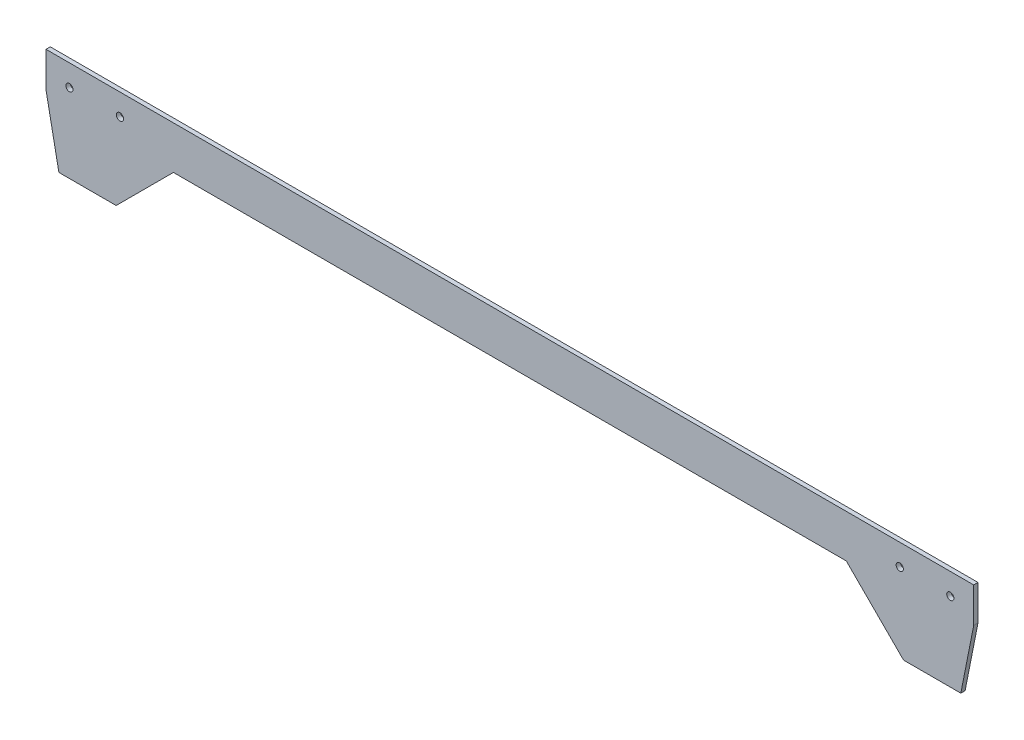
from build123d import *

# Parameters (mm, degrees)
CROQUIS1_R              = 5
SALIENTE_EXTRUIR1_DEPTH = 6


with BuildPart() as part:
    # Croquis1 → Saliente-Extruir1 (new body)
    with BuildSketch(Plane.XY):
        Polygon((-560, 30), (-600, 30), (-648, 30), (-648, -19), (-630, -110), (-600, -110), (-550, -110), (-470, -30), (470, -30), (550, -110), (600, -110), (630, -110), (648, -19), (648, 30), (600, 30), (560, 30), align=None)
        with Locations((-615.3, 0)):
            Circle(CROQUIS1_R, mode=Mode.SUBTRACT)
        with Locations((-544.7, 0)):
            Circle(CROQUIS1_R, mode=Mode.SUBTRACT)
        with Locations((544.7, 0)):
            Circle(CROQUIS1_R, mode=Mode.SUBTRACT)
        with Locations((615.3, 0)):
            Circle(CROQUIS1_R, mode=Mode.SUBTRACT)
    extrude(amount=SALIENTE_EXTRUIR1_DEPTH)


solid = part.part
